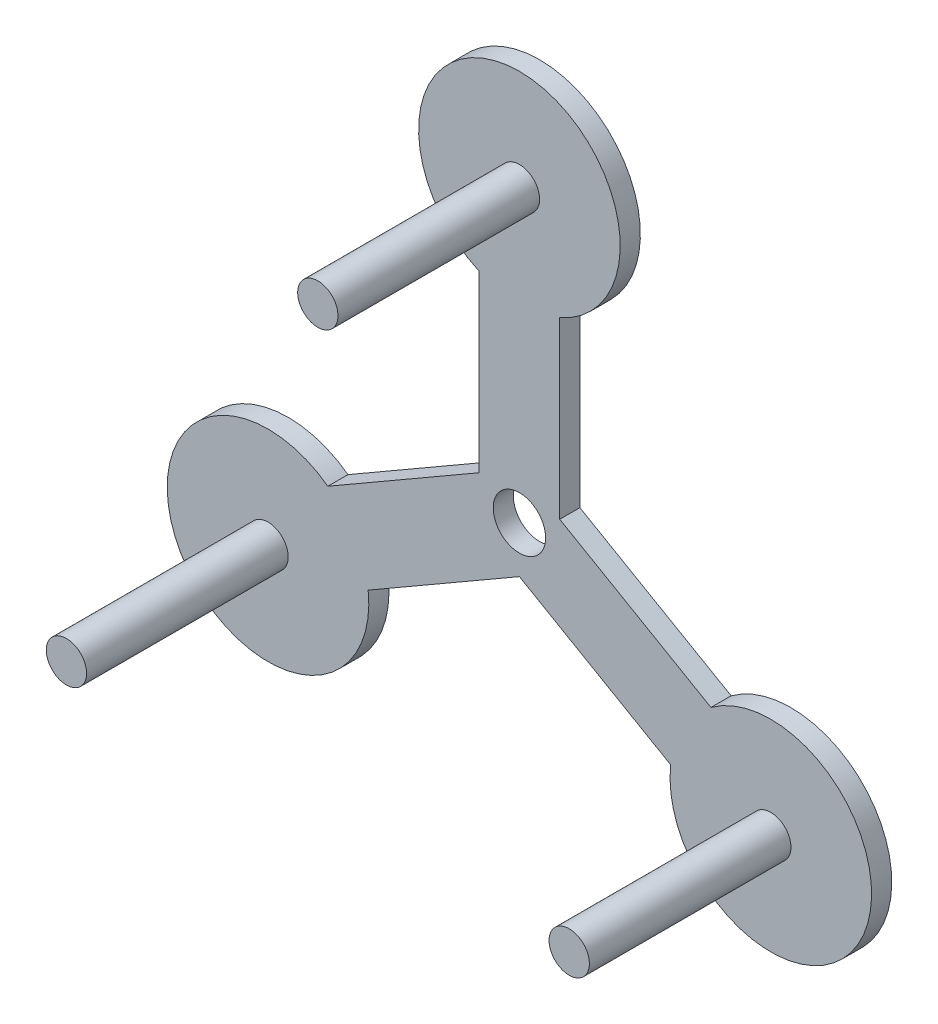
from build123d import *

# Parameters (mm, degrees)
BOSS_EXTRUDE2_DEPTH = 10
SKETCH3_R           = 50
BOSS_EXTRUDE3_DEPTH = 10
SKETCH4_R           = 10
BOSS_EXTRUDE4_DEPTH = 90
CUT_EXTRUDE1_START  = -30
SKETCH5_R           = 10
CUT_EXTRUDE1_DEPTH  = 30
SKETCH6_R           = 13
CUT_EXTRUDE2_DEPTH  = 10
SKETCH7_R           = 10
BOSS_EXTRUDE5_DEPTH = 30
SKETCH9_R           = 10
BOSS_EXTRUDE6_DEPTH = 10
SKETCH10_R          = 10
BOSS_EXTRUDE7_DEPTH = 10
SKETCH11_R          = 10
BOSS_EXTRUDE8_DEPTH = 10


with BuildPart() as part:
    # Sketch1 → Boss-Extrude2 (new body)
    with BuildSketch(Plane.XY):
        Polygon((20, 144), (-20, 144), (-20, 11.547005384), (-134.707658145, -54.679491924), (-114.707658145, -89.320508076), (0, -23.094010768), (114.707658145, -89.320508076), (134.707658145, -54.679491924), (20, 11.547005384), align=None)
    extrude(amount=BOSS_EXTRUDE2_DEPTH)

    # Sketch3 → Boss-Extrude3 (add)
    with BuildSketch(Plane.XY.offset(10)):
        with Locations((-124.707658145, -72)):
            Circle(SKETCH3_R)
        with Locations((0, 144)):
            Circle(SKETCH3_R)
        with Locations((124.707658145, -72)):
            Circle(SKETCH3_R)
    extrude(amount=-BOSS_EXTRUDE3_DEPTH)

    # Sketch4 → Boss-Extrude4 (add)
    with BuildSketch(Plane.XY.offset(10)):
        with Locations((0, 144)):
            Circle(SKETCH4_R)
        with Locations((124.707658145, -72)):
            Circle(SKETCH4_R)
        with Locations((-124.707658145, -72)):
            Circle(SKETCH4_R)
    extrude(amount=BOSS_EXTRUDE4_DEPTH)

    # Sketch5 → Cut-Extrude1 (cut)
    with BuildSketch(Plane.XY.offset(100).offset(CUT_EXTRUDE1_START)):
        with Locations((0, 144)):
            Circle(SKETCH5_R)
    extrude(amount=CUT_EXTRUDE1_DEPTH, mode=Mode.SUBTRACT)

    # Sketch6 → Cut-Extrude2 (cut)
    with BuildSketch(Plane.XY.offset(10)):
        Circle(SKETCH6_R)
    extrude(amount=-CUT_EXTRUDE2_DEPTH, mode=Mode.SUBTRACT)

    # Sketch7 → Boss-Extrude5 (add)
    with BuildSketch(Plane.XY.offset(70)):
        with Locations((0, 144)):
            Circle(SKETCH7_R)
    extrude(amount=BOSS_EXTRUDE5_DEPTH)

    # Sketch9 → Boss-Extrude6 (add)
    with BuildSketch(Plane.XY.offset(100)):
        with Locations((0, 144)):
            Circle(SKETCH9_R)
    extrude(amount=BOSS_EXTRUDE6_DEPTH)

    # Sketch10 → Boss-Extrude7 (add)
    with BuildSketch(Plane.XY.offset(100)):
        with Locations((-124.707658145, -72)):
            Circle(SKETCH10_R)
    extrude(amount=BOSS_EXTRUDE7_DEPTH)

    # Sketch11 → Boss-Extrude8 (add)
    with BuildSketch(Plane.XY.offset(100)):
        with Locations((124.707658145, -72)):
            Circle(SKETCH11_R)
    extrude(amount=BOSS_EXTRUDE8_DEPTH)


solid = part.part
